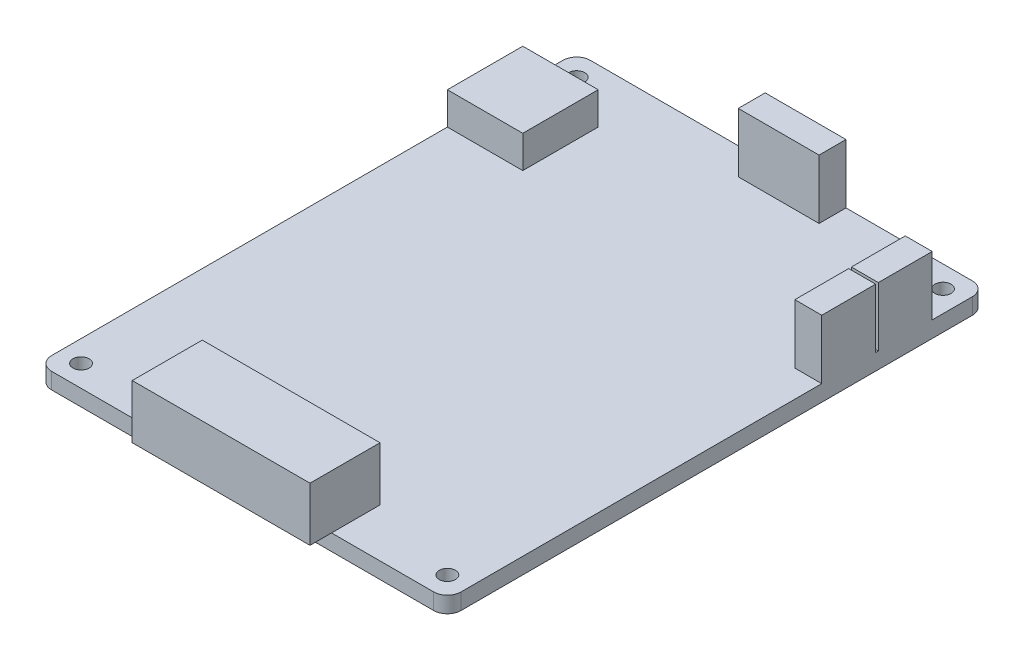
from build123d import *

# Parameters (mm, degrees)
SKETCH1_W           = 76
SKETCH1_H           = 100
BOSS_EXTRUDE1_DEPTH = 1.5
FILLET1_R           = 2.54
SKETCH2_R           = 1.5
CUT_EXTRUDE1_DEPTH  = 63.872887638
SKETCH3_W           = 33
SKETCH3_H           = 13
BOSS_EXTRUDE2_DEPTH = 10
SKETCH4_W           = 14
SKETCH4_H           = 14
BOSS_EXTRUDE3_DEPTH = 6
SKETCH5_W           = 15
SKETCH5_H           = 5
SKETCH5_W_2         = 5
SKETCH5_H_2         = 10
BOSS_EXTRUDE4_DEPTH = 11


with BuildPart() as part:
    # Sketch1 → Boss-Extrude1 (new, symmetric)
    with BuildSketch(Plane(origin=(0, 0, 0), x_dir=(1, 0, 0), z_dir=(0, 1, 0))):
        Rectangle(SKETCH1_W, SKETCH1_H)
    extrude(amount=BOSS_EXTRUDE1_DEPTH, both=True)

    # Fillet1
    fillet1_edges = [part.edges().sort_by_distance(p)[0] for p in [
        (-38, 0, -50),
        (38, 0, -50),
        (-38, 0, 50),
        (38, 0, 50),
    ]]
    fillet(fillet1_edges, radius=FILLET1_R)

    # Sketch2 → Cut-Extrude1 (cut, through all)
    with BuildSketch(Plane(origin=(0, 1.5, 0), x_dir=(1, 0, 0), z_dir=(0, 1, 0))):
        with Locations((-34, 46)):
            Circle(SKETCH2_R)
        with Locations((34, 46)):
            Circle(SKETCH2_R)
        with Locations((34, -46)):
            Circle(SKETCH2_R)
        with Locations((-34, -46)):
            Circle(SKETCH2_R)
    extrude(amount=-CUT_EXTRUDE1_DEPTH, mode=Mode.SUBTRACT)

    # Sketch3 → Boss-Extrude2 (add)
    with BuildSketch(Plane(origin=(0, 1.5, 0), x_dir=(1, 0, 0), z_dir=(0, 1, 0))):
        with Locations((0, -47.5)):
            Rectangle(SKETCH3_W, SKETCH3_H)
    extrude(amount=BOSS_EXTRUDE2_DEPTH)

    # Sketch4 → Boss-Extrude3 (add)
    with BuildSketch(Plane(origin=(0, 1.5, 0), x_dir=(1, 0, 0), z_dir=(0, 1, 0))):
        with Locations((-31, 33)):
            Rectangle(SKETCH4_W, SKETCH4_H)
    extrude(amount=BOSS_EXTRUDE3_DEPTH)

    # Sketch5 → Boss-Extrude4 (add)
    with BuildSketch(Plane(origin=(0, 1.5, 0), x_dir=(1, 0, 0), z_dir=(0, 1, 0))):
        with Locations((4.5, 47.5)):
            Rectangle(SKETCH5_W, SKETCH5_H)
        with Locations((35.5, 35)):
            Rectangle(SKETCH5_W_2, SKETCH5_H_2)
        with Locations((35.5, 24.5)):
            Rectangle(SKETCH5_W_2, SKETCH5_H_2)
    extrude(amount=BOSS_EXTRUDE4_DEPTH)


solid = part.part
